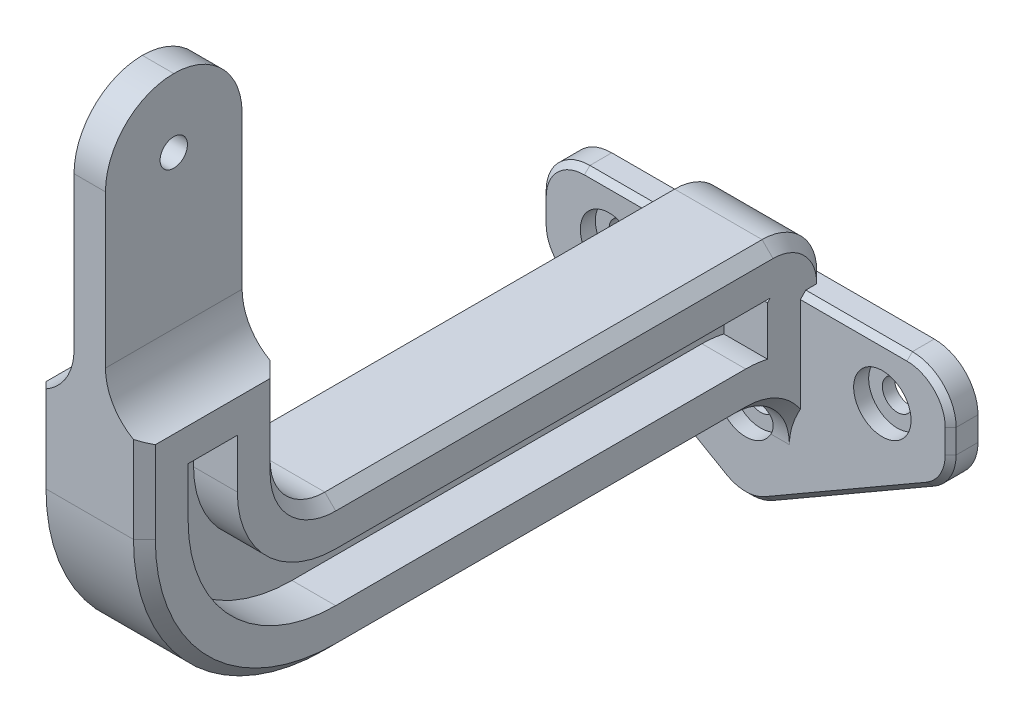
from build123d import *

# Parameters (mm, degrees)
BOSS_EXTRUDE1_DEPTH             = 5
FILLET1_R                       = 8
CBORE_FOR_M5_SBHCS1_D           = 5.5
CBORE_FOR_M5_SBHCS1_DEPTH       = 10
CBORE_FOR_M5_SBHCS1_CBORE_D     = 10.5
CBORE_FOR_M5_SBHCS1_CBORE_DEPTH = 2.75
CBORE_FOR_M5_SBHCS1_TIP         = 1.652366702
SKETCH7_W                       = 20
SKETCH7_H                       = 100
BOSS_EXTRUDE2_DEPTH             = 120
SKETCH8_W                       = 190
SKETCH8_H                       = 150
CUT_EXTRUDE1_DEPTH              = 72
FILLET2_R                       = 12.5
SKETCH9_W                       = 14.25
SKETCH9_H                       = 100
CUT_EXTRUDE2_DEPTH              = 72
SKETCH10_R                      = 2.5
CUT_EXTRUDE3_DEPTH              = 72
FILLET3_R                       = 10
FILLET4_R                       = 10
FILLET5_R                       = 35
FILLET6_R                       = 10
SKETCH12_W                      = 20
SKETCH12_H                      = 10
BOSS_EXTRUDE3_DEPTH             = 5
FILLET7_R                       = 10
CHAMFER1_SIZE                   = 2
CHAMFER2_SIZE                   = 1
CUT_EXTRUDE4_DEPTH              = 8


# Some blends are built 0.0001 mm under size
with BuildPart() as part:
    # Sketch2 → Boss-Extrude1 (new body)
    with BuildSketch(Plane.XY):
        Polygon((-37.5, 28.000635095), (0, 6.35), (37.5, 28.000635095), (37.5, 45), (-37.5, 45), align=None)
    extrude(amount=BOSS_EXTRUDE1_DEPTH)

    # Fillet1
    fillet1_edges = [part.edges().sort_by_distance(p)[0] for p in [
        (37.5, 28.000635095, 2.5),
        (0, 6.35, 2.5),
        (-37.5, 28.000635095, 2.5),
        (-37.5, 45, 2.5),
        (37.5, 45, 2.5),
    ]]
    fillet(fillet1_edges, radius=FILLET1_R)

    # CBORE for M5 SBHCS1
    with Locations(Plane.XY.offset(5)):
        with Locations((-25, 35), (0, 22.5), (25, 35)):
            CounterBoreHole(CBORE_FOR_M5_SBHCS1_D / 2, CBORE_FOR_M5_SBHCS1_CBORE_D / 2, CBORE_FOR_M5_SBHCS1_CBORE_DEPTH, depth=CBORE_FOR_M5_SBHCS1_DEPTH)
            with Locations((0, 0, -(CBORE_FOR_M5_SBHCS1_DEPTH + CBORE_FOR_M5_SBHCS1_TIP / 2))):  # 118° drill point
                Cone(0, CBORE_FOR_M5_SBHCS1_D / 2, CBORE_FOR_M5_SBHCS1_TIP, mode=Mode.SUBTRACT)

    # Sketch7 → Boss-Extrude2 (add)
    with BuildSketch(Plane.XY.offset(5)):
        with Locations((0, 80)):
            Rectangle(SKETCH7_W, SKETCH7_H)
    extrude(amount=BOSS_EXTRUDE2_DEPTH)

    # Sketch8 → Cut-Extrude1 (cut)
    with BuildSketch(Plane(origin=(10, 0, 0), x_dir=(0, 0, -1), z_dir=(1, 0, 0))):
        with Locations((-5, 130)):
            Rectangle(SKETCH8_W, SKETCH8_H)
    extrude(amount=-CUT_EXTRUDE1_DEPTH, mode=Mode.SUBTRACT)

    # Fillet2
    fillet2_edges = [part.edges().sort_by_distance(p)[0] for p in [
        (0, 130, 100),
        (0, 130, 125),
    ]]
    fillet(fillet2_edges, radius=FILLET2_R - 0.0001)  # a hair under: the kernel refuses the full size

    # Sketch9 → Cut-Extrude2 (cut)
    with BuildSketch(Plane.XY.offset(125)):
        with Locations((10, 130)):
            Rectangle(SKETCH9_W, SKETCH9_H)
        with Locations((-10, 130)):
            Rectangle(SKETCH9_W, SKETCH9_H)
    extrude(amount=-CUT_EXTRUDE2_DEPTH, mode=Mode.SUBTRACT)

    # Sketch10 → Cut-Extrude3 (cut)
    with BuildSketch(Plane(origin=(2.875, 0, 0), x_dir=(0, 0, -1), z_dir=(1, 0, 0))):
        with Locations((-112.5, 117.5)):
            Circle(SKETCH10_R)
    extrude(amount=-CUT_EXTRUDE3_DEPTH, mode=Mode.SUBTRACT)

    # Fillet3
    # the kernel refuses this fillet: 10 mm, written as the material it adds along each edge
    with BuildSketch(Plane(origin=(-2.875, 80, 125), x_dir=(-1, 0, 0), z_dir=(0, 0, -1))) as fillet3_piece_1:
        with BuildLine():
            CenterArc((10, 9.577806377), FILLET3_R, 180, 73.291656284)
            Line((0, 9.577806377), (-0.2, 9.577806377))
            Line((-0.2, 9.577806377), (-0.2, 0))
            Line((-0.2, 0), (0, -0.2))
            ThreePointArc((0, -0.2), (3.5625, -0.2), (7.0675, -0.191556128))
            Line((7.0675, -0.191556128), (7.125, 0))
        make_face()
    extrude(amount=25)
    with BuildSketch(Plane(origin=(2.875, 80, 125), x_dir=(0, 1, 0), z_dir=(0, 0, -1))) as fillet3_piece_2:
        with BuildLine():
            CenterArc((9.577806377, 10), FILLET3_R, 196.708343716, 73.291656284)
            Line((0, 7.125), (-0.191556128, 7.0675))
            ThreePointArc((-0.191556128, 7.0675), (-0.2, 3.5625), (-0.2, 0))
            Line((-0.2, 0), (0, -0.2))
            Line((0, -0.2), (9.577806377, -0.2))
            Line((9.577806377, -0.2), (9.577806377, 0))
        make_face()
    extrude(amount=25)

    # Fillet4
    fillet4_edges = [part.edges().sort_by_distance(p)[0] for p in [
        (0, 55, 100),
    ]]
    fillet(fillet4_edges, radius=FILLET4_R)

    # Fillet5
    fillet5_edges = [part.edges().sort_by_distance(p)[0] for p in [
        (0, 30, 125),
    ]]
    fillet(fillet5_edges, radius=FILLET5_R)

    # Fillet6
    # the kernel refuses this fillet: 10 mm, written as the material it adds along each edge
    with BuildSketch(Plane(origin=(10, 30, 5), x_dir=(0, 0, 1), z_dir=(-1, 0, 0))) as fillet6_piece_1_section:
        with BuildLine():
            CenterArc((FILLET6_R, -FILLET6_R), FILLET6_R, 90, 90)
            Line((0, -FILLET6_R), (0, 0))
            Line((0, 0), (FILLET6_R, 0))
        make_face()
    fillet6_piece_1 = extrude(amount=20, mode=Mode.PRIVATE)
    fillet6_piece_1 = fillet6_piece_1 - Plane(origin=(0, 22.5, 7.53044348), x_dir=(1, 0, 0), z_dir=(0, 0, 1)) * Cylinder(5.25, 80, mode=Mode.PRIVATE)
    add(fillet6_piece_1)

    # Sketch12 → Boss-Extrude3 (add)
    with BuildSketch(Plane(origin=(0, 0, 5), x_dir=(-1, 0, 0), z_dir=(0, 0, -1))):
        with Locations((0, 50)):
            Rectangle(SKETCH12_W, SKETCH12_H)
    extrude(amount=BOSS_EXTRUDE3_DEPTH)

    # Fillet7
    # the kernel refuses this fillet: 10 mm, written as the material it takes off along each edge
    with BuildSketch(Plane(origin=(-35, 55, 0), x_dir=(0, 0, 1), z_dir=(1, 0, 0))) as fillet7_piece_1:
        with BuildLine():
            CenterArc((FILLET7_R, FILLET7_R), FILLET7_R, 180, 90)
            Line((0, FILLET7_R), (0, 0))
            Line((0, 0), (FILLET7_R, 0))
        make_face()
    extrude(amount=70, mode=Mode.SUBTRACT)

    # Chamfer1
    # the kernel refuses this chamfer: 2 mm, written as the material it takes off along each edge
    with BuildSketch(Plane(origin=(-10, 65, 100), x_dir=(-0.02749587661058987, 0, 0.9996219169112968), z_dir=(0, 1, 0)), Plane(origin=(10, 85.143365976, 100), x_dir=(0.027495876610586414, 0, 0.9996219169112968), z_dir=(0, -1, 0))) as chamfer1_piece_1:
        Polygon((CHAMFER1_SIZE * 0.999621916911, CHAMFER1_SIZE * 0.0274958766106), (-CHAMFER1_SIZE * 0.0274958766106, CHAMFER1_SIZE * 0.999621916911), (0, 0), align=None)
    extrude(amount=20.143365976, mode=Mode.SUBTRACT)
    with BuildSketch(Plane(origin=(-10, 65, 125), x_dir=(-0.02749587661058987, 0, -0.9996219169112968), z_dir=(0, 1, 0)), Plane(origin=(10, 85.143365976, 125), x_dir=(0.027495876610586414, 0, -0.9996219169112968), z_dir=(0, -1, 0))) as chamfer1_piece_2:
        Polygon((CHAMFER1_SIZE * 0.999621916911, -CHAMFER1_SIZE * 0.0274958766106), (-CHAMFER1_SIZE * 0.0274958766106, -CHAMFER1_SIZE * 0.999621916911), (0, 0), align=None)
    extrude(amount=20.143365976, mode=Mode.SUBTRACT)
    with BuildSketch(Plane(origin=(-10, 55, 10), x_dir=(-0.027495876610589956, -0.9996219169112965, 0), z_dir=(0, 0, 1)), Plane(origin=(10, 55, 90), x_dir=(0.0274958766105822, -0.999621916911297, 0), z_dir=(0, 0, -1))) as chamfer1_piece_3:
        Polygon((CHAMFER1_SIZE * 0.999621916911, CHAMFER1_SIZE * 0.0274958766106), (-CHAMFER1_SIZE * 0.0274958766106, CHAMFER1_SIZE * 0.999621916911), (0, 0), align=None)
    extrude(amount=80, mode=Mode.SUBTRACT)
    with BuildSketch(Plane(origin=(10, 65, 90), x_dir=(0, 0, 1), z_dir=(0, 1, 0))) as chamfer1_piece_4:
        Polygon((10 + CHAMFER1_SIZE, 0), (10, -CHAMFER1_SIZE), (10, 0), align=None)
    revolve(axis=Axis((10, 65, 90), (1, 0, 0)), revolution_arc=90, mode=Mode.SUBTRACT)
    with BuildSketch(Plane(origin=(-10, 65, 90), x_dir=(0, 0, 1), z_dir=(0, 1, 0))) as chamfer1_piece_5:
        Polygon((10 + CHAMFER1_SIZE, 0), (10, CHAMFER1_SIZE), (10, 0), align=None)
    revolve(axis=Axis((-10, 65, 90), (1, 0, 0)), revolution_arc=90, mode=Mode.SUBTRACT)
    with BuildSketch(Plane(origin=(10, 30, 15), x_dir=(0.027495876610581334, 0.999621916911297, 0), z_dir=(0, 0, 1)), Plane(origin=(-10, 30, 15), x_dir=(0.9996219169112968, -0.027495876610585623, 0), z_dir=(0, 0, 1))) as chamfer1_piece_6:
        Polygon((CHAMFER1_SIZE * 0.999621916911, CHAMFER1_SIZE * 0.0274958766106), (-CHAMFER1_SIZE * 0.0274958766106, CHAMFER1_SIZE * 0.999621916911), (0, 0), align=None)
    extrude(amount=75, mode=Mode.SUBTRACT)
    with BuildSketch(Plane(origin=(10, 65, 90), x_dir=(0, 0, 1), z_dir=(0, 1, 0))) as chamfer1_piece_7:
        Polygon((35 - CHAMFER1_SIZE, 0), (35, -CHAMFER1_SIZE), (35, 0), align=None)
    revolve(axis=Axis((10, 65, 90), (1, 0, 0)), revolution_arc=90, mode=Mode.SUBTRACT)
    with BuildSketch(Plane(origin=(-10, 65, 90), x_dir=(0, 0, 1), z_dir=(0, 1, 0))) as chamfer1_piece_8:
        Polygon((35 - CHAMFER1_SIZE, 0), (35, CHAMFER1_SIZE), (35, 0), align=None)
    revolve(axis=Axis((-10, 65, 90), (1, 0, 0)), revolution_arc=90, mode=Mode.SUBTRACT)
    with BuildSketch(Plane(origin=(10, 20, 15), x_dir=(0, 1, 0), z_dir=(0, 0, 1))) as chamfer1_piece_9_section:
        Polygon((10, CHAMFER1_SIZE), (10 + CHAMFER1_SIZE, 0), (10, 0), align=None)
    chamfer1_piece_9 = revolve(axis=Axis((10, 20, 15), (-1, 0, 0)), revolution_arc=119.481154356, mode=Mode.PRIVATE)
    chamfer1_piece_9 = split(chamfer1_piece_9, bisect_by=Plane(origin=(9.27752792, 27.153705444, 5), z_dir=(0, 0, 1)), keep=Keep.TOP, mode=Mode.PRIVATE)
    add(chamfer1_piece_9, mode=Mode.SUBTRACT)
    with BuildSketch(Plane(origin=(-10, 20, 15), x_dir=(0, 1, 0), z_dir=(0, 0, 1))) as chamfer1_piece_10_section:
        Polygon((10, -CHAMFER1_SIZE), (10 + CHAMFER1_SIZE, 0), (10, 0), align=None)
    chamfer1_piece_10 = revolve(axis=Axis((-10, 20, 15), (-1, 0, 0)), revolution_arc=119.481154356, mode=Mode.PRIVATE)
    chamfer1_piece_10 = split(chamfer1_piece_10, bisect_by=Plane(origin=(-9.27752792, 27.153705444, 5), z_dir=(0, 0, 1)), keep=Keep.TOP, mode=Mode.PRIVATE)
    add(chamfer1_piece_10, mode=Mode.SUBTRACT)
    with BuildSketch(Plane(origin=(10, 45, 10), x_dir=(0, 1, 0), z_dir=(0, 0, 1))) as chamfer1_piece_11:
        Polygon((10 - CHAMFER1_SIZE, 0), (10, CHAMFER1_SIZE), (10, 0), align=None)
    revolve(axis=Axis((10, 45, 10), (-1, 0, 0)), revolution_arc=90, mode=Mode.SUBTRACT)
    with BuildSketch(Plane(origin=(-10, 45, 10), x_dir=(0, 1, 0), z_dir=(0, 0, 1))) as chamfer1_piece_12:
        Polygon((10 - CHAMFER1_SIZE, 0), (10, -CHAMFER1_SIZE), (10, 0), align=None)
    revolve(axis=Axis((-10, 45, 10), (-1, 0, 0)), revolution_arc=90, mode=Mode.SUBTRACT)

    # Chamfer2
    chamfer2_edges = [part.edges().sort_by_distance(p)[0] for p in [
        (-37.5, 34.809718624, 5),
        (19.75, 45, 5),
        (37.5, 34.809718624, 5),
        (-18.75, 17.175317547, 5),
        (18.75, 17.175317547, 5),
        (35.156854249, 42.656854249, 5),
        (36.42820323, 28.619437248, 5),
        (0, 7.587604307, 5),
        (-36.42820323, 28.619437248, 5),
        (-35.156854249, 42.656854249, 5),
        (-19.75, 45, 5),
    ]]
    chamfer(chamfer2_edges, length=CHAMFER2_SIZE)

    # Sketch13 → Cut-Extrude4 (cut)
    with BuildSketch(Plane(origin=(10, 0, 0), x_dir=(0, 0, -1), z_dir=(1, 0, 0))):
        with BuildLine():
            Line((-11, 37.549928775), (-11, 46.485281374))
            Line((-11, 46.485281374), (-10.485281374, 47))
            Line((-10.485281374, 47), (-90, 47))
            ThreePointArc((-90, 47), (-102.727922061, 52.272077939), (-108, 65))
            Line((-108, 65), (-108, 74))
            Line((-108, 74), (-117, 74))
            Line((-117, 74), (-117, 65))
            ThreePointArc((-117, 65), (-109.091883092, 45.908116908), (-90, 38))
            Line((-90, 38), (-15, 38))
            ThreePointArc((-15, 38), (-12.987379562, 37.887128304), (-11, 37.549928775))
        make_face()
    cut_extrude4 = extrude(amount=-CUT_EXTRUDE4_DEPTH, mode=Mode.SUBTRACT)

    # Mirror1: Cut-Extrude4 across plane
    add(cut_extrude4.mirror(Plane(origin=(0, 0, 0), x_dir=(0, 0, 1), z_dir=(1, 0, 0))), mode=Mode.SUBTRACT)


solid = part.part
